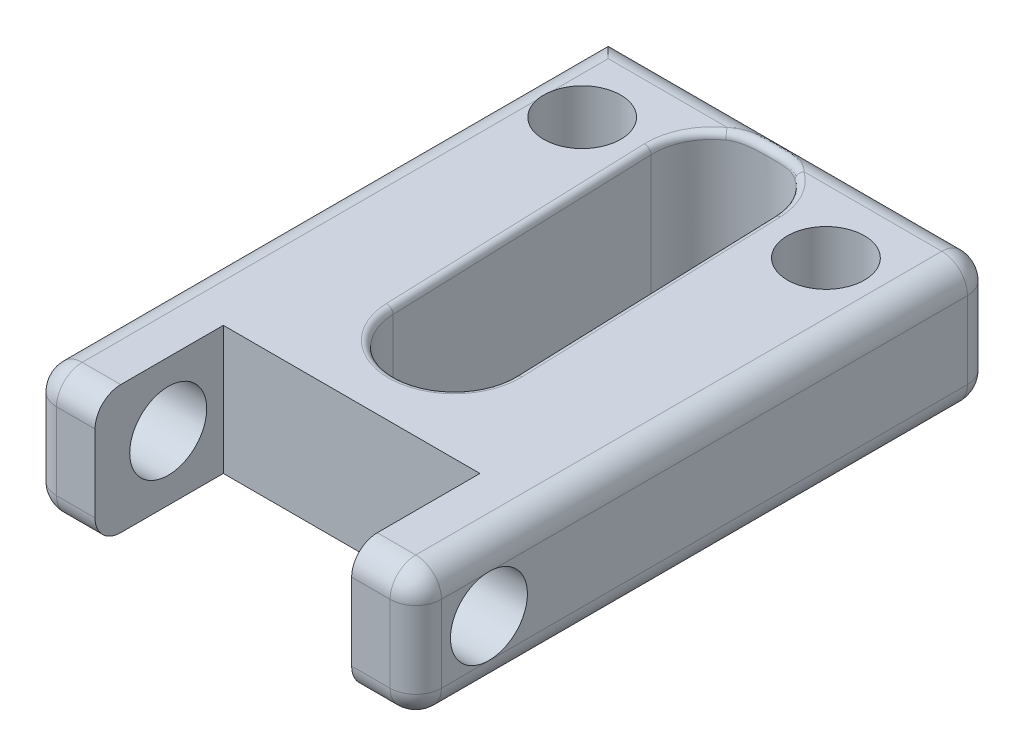
from build123d import *

# Parameters (mm, degrees)
SKETCH1_W           = 30
SKETCH1_H           = 45
BOSS_EXTRUDE1_DEPTH = 10
SKETCH2_W           = 20
SKETCH2_H           = 10
CUT_EXTRUDE1_DEPTH  = 29.831406487
FILLET1_R           = 2
FILLET3_R           = 0.5
SKETCH3_R           = 3
CUT_EXTRUDE2_DEPTH  = 39.810436902
SKETCH4_R           = 3
CUT_EXTRUDE3_DEPTH  = 20


with BuildPart() as part:
    # Sketch1 → Boss-Extrude1 (new body)
    with BuildSketch(Plane(origin=(0, 0, 0), x_dir=(1, 0, 0), z_dir=(0, 1, 0))):
        Rectangle(SKETCH1_W, SKETCH1_H)
    extrude(amount=BOSS_EXTRUDE1_DEPTH)

    # Sketch2 → Cut-Extrude1 (cut, through all)
    with BuildSketch(Plane(origin=(0, 10, 0), x_dir=(1, 0, 0), z_dir=(0, 1, 0))):
        with BuildLine():
            Line((3.893045877, 16.501804419), (4.618557503, -4.339220132))
            ThreePointArc((4.618557503, -4.339220132), (0.160779868, -9.118557503), (-4.618557503, -4.660779868))
            Line((-4.618557503, -4.660779868), (-5.34406913, 16.180244684))
            ThreePointArc((-5.34406913, 16.180244684), (-0.886291494, 20.959582055), (3.893045877, 16.501804419))
        make_face()
        with Locations((0, -17.5)):
            Rectangle(SKETCH2_W, SKETCH2_H)
    extrude(amount=-CUT_EXTRUDE1_DEPTH, mode=Mode.SUBTRACT)

    # Fillet1
    # the kernel refuses this fillet: 2 mm, written as the material it takes off along each edge
    with BuildSketch(Plane(origin=(-13, 8, 20.5), x_dir=(0, 1, 0), z_dir=(-1, 0, 0))) as fillet1_piece_1_section:
        Polygon((0, 0), (FILLET1_R, 0), (FILLET1_R, -FILLET1_R), (0, -FILLET1_R), align=None)
    fillet1_piece_1 = extrude(amount=FILLET1_R, mode=Mode.PRIVATE)
    fillet1_piece_1 = fillet1_piece_1 - Plane(origin=(-13, 8, 20.5), x_dir=(0, -0.7071067811865475, -0.7071067811865475), z_dir=(-1, 0, 0)) * Sphere(FILLET1_R, mode=Mode.PRIVATE)
    add(fillet1_piece_1, mode=Mode.SUBTRACT)
    with BuildSketch(Plane(origin=(13, 2, 20.5), x_dir=(0, -1, 0), z_dir=(1, 0, 0))) as fillet1_piece_2_section:
        Polygon((0, 0), (FILLET1_R, 0), (FILLET1_R, -FILLET1_R), (0, -FILLET1_R), align=None)
    fillet1_piece_2 = extrude(amount=FILLET1_R, mode=Mode.PRIVATE)
    fillet1_piece_2 = fillet1_piece_2 - Plane(origin=(13, 2, 20.5), x_dir=(0, 0.7071067811865475, -0.7071067811865475), z_dir=(1, 0, 0)) * Sphere(FILLET1_R, mode=Mode.PRIVATE)
    add(fillet1_piece_2, mode=Mode.SUBTRACT)
    with BuildSketch(Plane(origin=(13, 8, 20.5), x_dir=(0, 1, 0), z_dir=(1, 0, 0))) as fillet1_piece_3_section:
        Polygon((0, 0), (FILLET1_R, 0), (FILLET1_R, FILLET1_R), (0, FILLET1_R), align=None)
    fillet1_piece_3 = extrude(amount=FILLET1_R, mode=Mode.PRIVATE)
    fillet1_piece_3 = fillet1_piece_3 - Plane(origin=(13, 8, 20.5), x_dir=(0, -0.7071067811865475, -0.7071067811865475), z_dir=(1, 0, 0)) * Sphere(FILLET1_R, mode=Mode.PRIVATE)
    add(fillet1_piece_3, mode=Mode.SUBTRACT)
    with BuildSketch(Plane(origin=(13, 8, -20.5), x_dir=(1, 0, 0), z_dir=(0, 0, -1))) as fillet1_piece_4_section:
        Polygon((0, 0), (FILLET1_R, 0), (FILLET1_R, -FILLET1_R), (0, -FILLET1_R), align=None)
    fillet1_piece_4 = extrude(amount=FILLET1_R, mode=Mode.PRIVATE)
    fillet1_piece_4 = fillet1_piece_4 - Plane(origin=(13, 8, -20.5), x_dir=(-0.7071067811865475, -0.7071067811865475, 0), z_dir=(0, 0, -1)) * Sphere(FILLET1_R, mode=Mode.PRIVATE)
    add(fillet1_piece_4, mode=Mode.SUBTRACT)
    with BuildSketch(Plane(origin=(-13, 2, 20.5), x_dir=(0, -1, 0), z_dir=(-1, 0, 0))) as fillet1_piece_5_section:
        Polygon((0, 0), (FILLET1_R, 0), (FILLET1_R, FILLET1_R), (0, FILLET1_R), align=None)
    fillet1_piece_5 = extrude(amount=FILLET1_R, mode=Mode.PRIVATE)
    fillet1_piece_5 = fillet1_piece_5 - Plane(origin=(-13, 2, 20.5), x_dir=(0, 0.7071067811865475, -0.7071067811865475), z_dir=(-1, 0, 0)) * Sphere(FILLET1_R, mode=Mode.PRIVATE)
    add(fillet1_piece_5, mode=Mode.SUBTRACT)
    with BuildSketch(Plane(origin=(13, 2, -20.5), x_dir=(1, 0, 0), z_dir=(0, 0, -1))) as fillet1_piece_6_section:
        Polygon((0, 0), (FILLET1_R, 0), (FILLET1_R, FILLET1_R), (0, FILLET1_R), align=None)
    fillet1_piece_6 = extrude(amount=FILLET1_R, mode=Mode.PRIVATE)
    fillet1_piece_6 = fillet1_piece_6 - Plane(origin=(13, 2, -20.5), x_dir=(-0.7071067811865475, 0.7071067811865475, 0), z_dir=(0, 0, -1)) * Sphere(FILLET1_R, mode=Mode.PRIVATE)
    add(fillet1_piece_6, mode=Mode.SUBTRACT)
    with BuildSketch(Plane(origin=(-15, 10, 20.5), x_dir=(0, -1, 0), z_dir=(0, 0, -1))) as fillet1_piece_7:
        with BuildLine():
            CenterArc((FILLET1_R, -FILLET1_R), FILLET1_R, 90, 90)
            Line((0, -FILLET1_R), (0, 0))
            Line((0, 0), (FILLET1_R, 0))
        make_face()
    extrude(amount=48, mode=Mode.SUBTRACT)
    with BuildSketch(Plane(origin=(-5, 10, 22.5), x_dir=(0, 0, -1), z_dir=(-1, 0, 0)), Plane(origin=(13, 10, 22.5), x_dir=(0, 0, -1), z_dir=(-1, 0, 0))) as fillet1_piece_8:
        with BuildLine():
            CenterArc((FILLET1_R, FILLET1_R), FILLET1_R, 180, 90)
            Line((0, FILLET1_R), (0, 0))
            Line((0, 0), (FILLET1_R, 0))
        make_face()
    extrude(amount=8, mode=Mode.SUBTRACT)
    with BuildSketch(Plane(origin=(13, 0, 22.5), x_dir=(0, 0, -1), z_dir=(-1, 0, 0)), Plane(origin=(-5, 0, 22.5), x_dir=(0, 0, -1), z_dir=(-1, 0, 0))) as fillet1_piece_9:
        with BuildLine():
            CenterArc((FILLET1_R, -FILLET1_R), FILLET1_R, 90, 90)
            Line((0, -FILLET1_R), (0, 0))
            Line((0, 0), (FILLET1_R, 0))
        make_face()
    extrude(amount=8, mode=Mode.SUBTRACT)
    with BuildSketch(Plane(origin=(15, 10, -20.5), x_dir=(0, -1, 0), z_dir=(0, 0, 1))) as fillet1_piece_10:
        with BuildLine():
            CenterArc((FILLET1_R, -FILLET1_R), FILLET1_R, 90, 90)
            Line((0, -FILLET1_R), (0, 0))
            Line((0, 0), (FILLET1_R, 0))
        make_face()
    extrude(amount=41, mode=Mode.SUBTRACT)
    with BuildSketch(Plane(origin=(-15, 0, 20.5), x_dir=(0, 1, 0), z_dir=(0, 0, -1))) as fillet1_piece_11:
        with BuildLine():
            CenterArc((FILLET1_R, FILLET1_R), FILLET1_R, 180, 90)
            Line((0, FILLET1_R), (0, 0))
            Line((0, 0), (FILLET1_R, 0))
        make_face()
    extrude(amount=48, mode=Mode.SUBTRACT)
    with BuildSketch(Plane(origin=(-20, 0, -22.5), x_dir=(0, 1, 0), z_dir=(1, 0, 0))) as fillet1_piece_12:
        with BuildLine():
            CenterArc((FILLET1_R, FILLET1_R), FILLET1_R, 180, 90)
            Line((0, FILLET1_R), (0, 0))
            Line((0, 0), (FILLET1_R, 0))
        make_face()
    extrude(amount=33, mode=Mode.SUBTRACT)
    with BuildSketch(Plane(origin=(15, 0, -20.5), x_dir=(0, 1, 0), z_dir=(0, 0, 1))) as fillet1_piece_13:
        with BuildLine():
            CenterArc((FILLET1_R, FILLET1_R), FILLET1_R, 180, 90)
            Line((0, FILLET1_R), (0, 0))
            Line((0, 0), (FILLET1_R, 0))
        make_face()
    extrude(amount=41, mode=Mode.SUBTRACT)
    with BuildSketch(Plane(origin=(-20, 10, -22.5), x_dir=(0, -1, 0), z_dir=(1, 0, 0))) as fillet1_piece_14:
        with BuildLine():
            CenterArc((FILLET1_R, -FILLET1_R), FILLET1_R, 90, 90)
            Line((0, -FILLET1_R), (0, 0))
            Line((0, 0), (FILLET1_R, 0))
        make_face()
    extrude(amount=33, mode=Mode.SUBTRACT)
    with BuildSketch(Plane(origin=(15, 2, 22.5), x_dir=(0, 0, -1), z_dir=(0, 1, 0)), Plane(origin=(15, 2, -22.5), x_dir=(-1, 0, 0), z_dir=(0, 1, 0))) as fillet1_piece_15:
        with BuildLine():
            CenterArc((FILLET1_R, FILLET1_R), FILLET1_R, 180, 90)
            Line((0, FILLET1_R), (0, 0))
            Line((0, 0), (FILLET1_R, 0))
        make_face()
    extrude(amount=6, mode=Mode.SUBTRACT)
    with BuildSketch(Plane(origin=(-15, 2, 22.5), x_dir=(0, 0, -1), z_dir=(0, 1, 0))) as fillet1_piece_16:
        with BuildLine():
            CenterArc((FILLET1_R, -FILLET1_R), FILLET1_R, 90, 90)
            Line((0, -FILLET1_R), (0, 0))
            Line((0, 0), (FILLET1_R, 0))
        make_face()
    extrude(amount=6, mode=Mode.SUBTRACT)

    # Fillet3
    fillet3_edges = [part.edges().sort_by_distance(p)[0] for p in [
        (3.14709757, 10, -18.862893222),
        (-4.981313317, 10, -5.759732408),
        (0.160779868, 10, 9.118557503),
        (4.25580169, 10, -6.081292143),
        (-4.683513839, 10, -18.726636018),
        (-0.725511627, 9.945817308, -20.962379718),
    ]]
    fillet(fillet3_edges, radius=FILLET3_R)

    # Sketch3 → Cut-Extrude2 (cut, through all)
    with BuildSketch(Plane(origin=(15, 0, 0), x_dir=(0, 0, -1), z_dir=(1, 0, 0))):
        with Locations(Location((-16.797241127, 5.024030388, 0), (0, 0, 82.743157185))):
            Circle(SKETCH3_R)
    extrude(amount=-CUT_EXTRUDE2_DEPTH, mode=Mode.SUBTRACT)

    # Sketch4 → Cut-Extrude3 (cut)
    with BuildSketch(Plane(origin=(0, 10, 0), x_dir=(1, 0, 0), z_dir=(0, 1, 0))):
        with Locations(Location((8.935504807, 15.535947381, 0), (0, 0, 270))):
            Circle(SKETCH4_R)
        with Locations(Location((-10.064495193, 15.535947381, 0), (0, 0, 191.902051239))):
            Circle(SKETCH4_R)
    extrude(amount=-CUT_EXTRUDE3_DEPTH, mode=Mode.SUBTRACT)


solid = part.part
